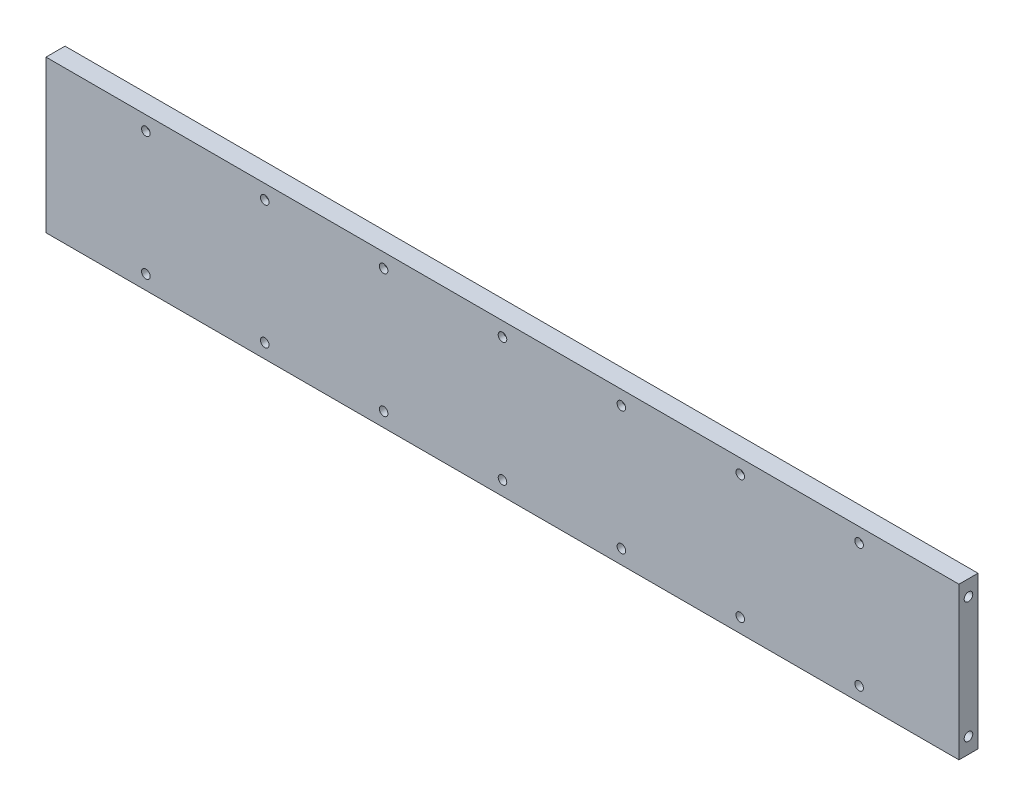
from build123d import *

# Parameters (mm, degrees)
SKETCH1_W           = 384
SKETCH1_H           = 64
SKETCH1_R           = 1.8
BOSS_EXTRUDE1_DEPTH = 8
CUT_EXTRUDE1_REACH  = 387.414
SKETCH2_R           = 1.8


with BuildPart() as part:
    # Sketch1 → Boss-Extrude1 (new body)
    with BuildSketch(Plane.XY):
        Rectangle(SKETCH1_W, SKETCH1_H)
        with Locations((0, 26)):
            Circle(SKETCH1_R, mode=Mode.SUBTRACT)
        with Locations((50, 26)):
            Circle(SKETCH1_R, mode=Mode.SUBTRACT)
        with Locations((100, 26)):
            Circle(SKETCH1_R, mode=Mode.SUBTRACT)
        with Locations((150, 26)):
            Circle(SKETCH1_R, mode=Mode.SUBTRACT)
        with Locations((-50, 26)):
            Circle(SKETCH1_R, mode=Mode.SUBTRACT)
        with Locations((-100, 26)):
            Circle(SKETCH1_R, mode=Mode.SUBTRACT)
        with Locations((-150, 26)):
            Circle(SKETCH1_R, mode=Mode.SUBTRACT)
        with Locations((-150, -26)):
            Circle(SKETCH1_R, mode=Mode.SUBTRACT)
        with Locations((-100, -26)):
            Circle(SKETCH1_R, mode=Mode.SUBTRACT)
        with Locations((-50, -26)):
            Circle(SKETCH1_R, mode=Mode.SUBTRACT)
        with Locations((150, -26)):
            Circle(SKETCH1_R, mode=Mode.SUBTRACT)
        with Locations((100, -26)):
            Circle(SKETCH1_R, mode=Mode.SUBTRACT)
        with Locations((50, -26)):
            Circle(SKETCH1_R, mode=Mode.SUBTRACT)
        with Locations((0, -26)):
            Circle(SKETCH1_R, mode=Mode.SUBTRACT)
    extrude(amount=BOSS_EXTRUDE1_DEPTH)

    # Sketch2 → Cut-Extrude1 (cut, up to next)
    with BuildSketch(Plane.ZY.offset(192), mode=Mode.PRIVATE) as cut_extrude1_sk1:
        with Locations((4, 25.445)):
            Circle(SKETCH2_R)
    cut_extrude1_tool1 = extrude(cut_extrude1_sk1.sketch, amount=-CUT_EXTRUDE1_REACH, mode=Mode.PRIVATE) & part.part
    # Sketch2 → Cut-Extrude1 (cut, up to next)
    with BuildSketch(Plane.ZY.offset(192), mode=Mode.PRIVATE) as cut_extrude1_sk2:
        with Locations((4, -25.445)):
            Circle(SKETCH2_R)
    cut_extrude1_tool2 = extrude(cut_extrude1_sk2.sketch, amount=-CUT_EXTRUDE1_REACH, mode=Mode.PRIVATE) & part.part
    add(cut_extrude1_tool1.solids().sort_by_distance((-192, 25.445, 4))[0], mode=Mode.SUBTRACT)
    add(cut_extrude1_tool2.solids().sort_by_distance((-192, -25.445, 4))[0], mode=Mode.SUBTRACT)


solid = part.part
